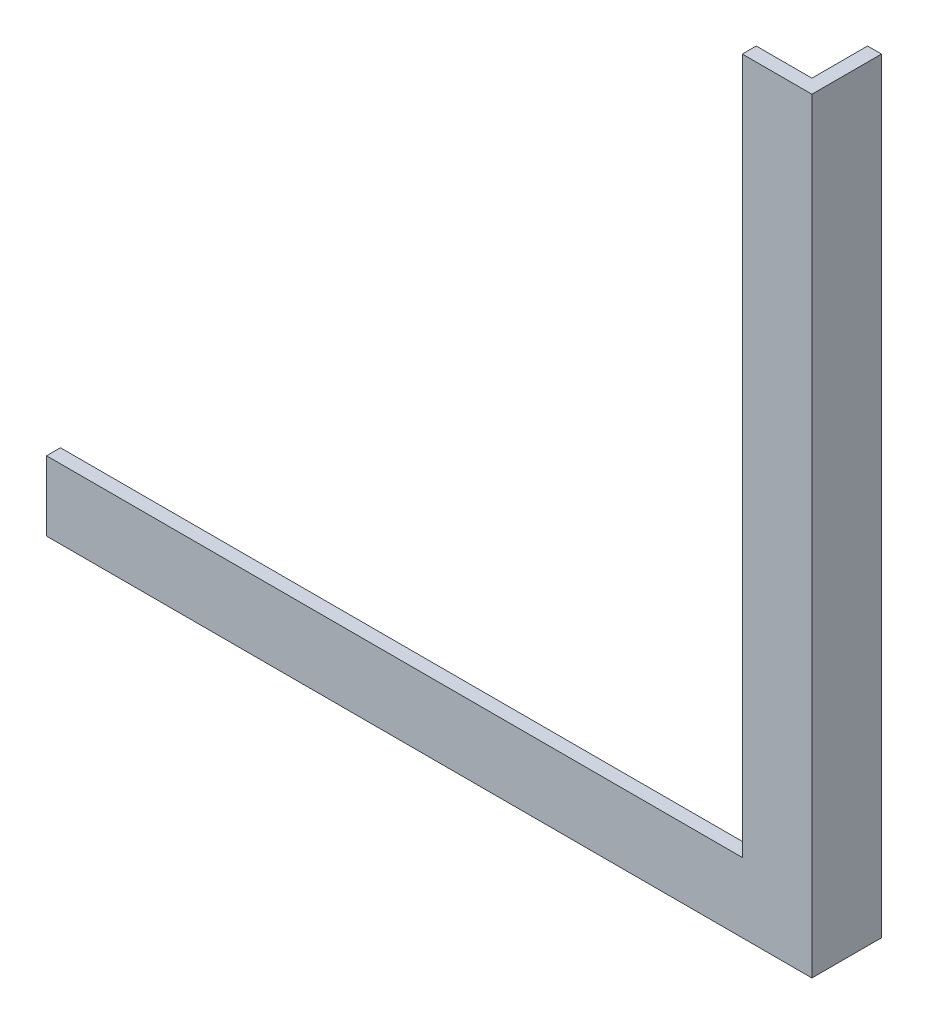
from build123d import *

# Parameters (mm, degrees)
BOSS_EXTRUDE1_DEPTH = 15
CUT_EXTRUDE1_DEPTH  = 12


with BuildPart() as part:
    # Sketch1 → Boss-Extrude1 (new body)
    with BuildSketch(Plane.XY):
        Polygon((0, 0), (0, 150), (15, 150), (15, -15), (-150, -15), (-150, 0), align=None)
    extrude(amount=BOSS_EXTRUDE1_DEPTH)

    # Sketch2 → Cut-Extrude1 (cut)
    with BuildSketch(Plane(origin=(0, 0, 0), x_dir=(-1, 0, 0), z_dir=(0, 0, -1))):
        Polygon((0, 150), (-12, 150), (-12, -12), (150, -12), (150, 0), (0, 0), align=None)
    extrude(amount=-CUT_EXTRUDE1_DEPTH, mode=Mode.SUBTRACT)


solid = part.part
